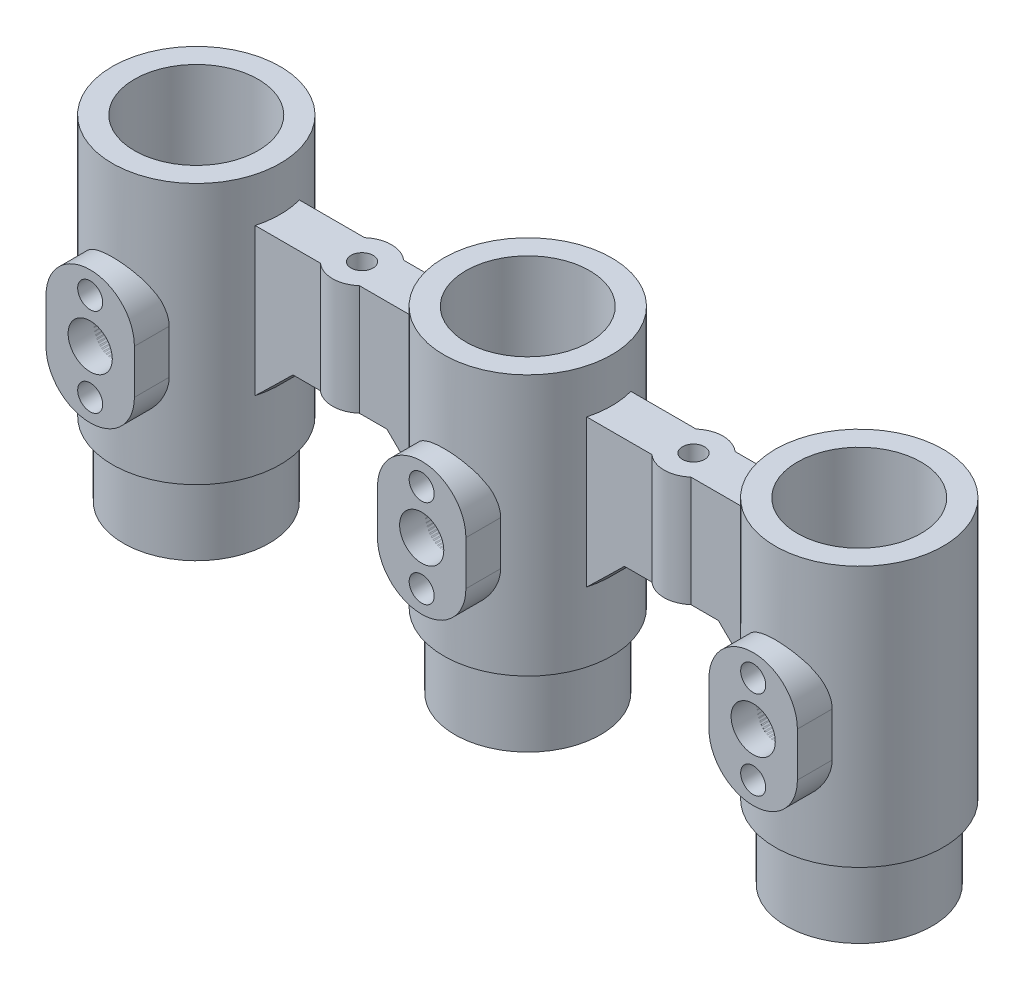
from build123d import *

# Parameters (mm, degrees)
SKETCH2_R           = 1.5
BOSS_EXTRUDE1_DEPTH = 15
SKETCH9_W           = 166.38618034
SKETCH9_H           = 90.507519626
CUT_EXTRUDE1_DEPTH  = 4
CHAMFER1_SIZE       = 5
SKETCH16_R          = 1.7
SKETCH16_R_2        = 3
BOSS_EXTRUDE9_DEPTH = 3
SKETCH16_8_R        = 1.7
SKETCH16_8_R_2      = 3
CUT_EXTRUDE7_DEPTH  = 10
LPATTERN11_COUNT    = 3
LPATTERN11_PITCH    = 45
LPATTERN11_2_COUNT  = 3
LPATTERN11_2_PITCH  = 45


with BuildPart() as part:
    # Sketch1 → Revolve2 (revolve)
    with BuildSketch(Plane.XY):
        Polygon((9.9, 14.584681722), (11.4, 14.584681722), (11.4, 54), (8.4, 54), (8.4, 4.584681722), (9.9, 4.584681722), align=None)
    revolve(axis=Axis((0, 51.150081367, 0), (0, -1, 0)))



with BuildPart() as body_2:
    # Sketch1<5> → Revolve3 (revolve)
    with BuildSketch(Plane.XY):
        Polygon((-35.1, 14.584681722), (-33.6, 14.584681722), (-33.6, 54), (-36.6, 54), (-36.6, 4.584681722), (-35.1, 4.584681722), align=None)
    revolve(axis=Axis((-45, 51.150081367, 0), (0, -1, 0)))


with BuildPart() as body_3:
    # Sketch1<6> → Revolve4 (revolve)
    with BuildSketch(Plane.XY):
        Polygon((56.4, 54), (53.4, 54), (53.4, 4.584681722), (54.9, 4.584681722), (54.9, 14.584681722), (56.4, 14.584681722), align=None)
    revolve(axis=Axis((45, 51.150081367, 0), (0, -1, 0)))


with BuildPart() as part_1:
    add(part.part)

    add(body_2.part)  # Boss-Extrude1 merges body 2

    add(body_3.part)  # Boss-Extrude1 merges body 3
    # Sketch2 → Boss-Extrude1 (add)
    # profile 1 of 2: a face of its own
    with BuildSketch(Plane(origin=(0, 44, 0), x_dir=(1, 0, 0), z_dir=(0, 1, 0))):
        with BuildLine():
            Line((10.998181668, 3), (10.998181668, -3))
            Line((10.998181668, -3), (19.854248689, -3))
            ThreePointArc((19.854248689, -3), (22.5, -4), (25.145751311, -3))
            Line((25.145751311, -3), (34.001818332, -3))
            Line((34.001818332, -3), (34.001818332, 3))
            Line((34.001818332, 3), (25.145751311, 3))
            ThreePointArc((25.145751311, 3), (22.5, 4), (19.854248689, 3))
            Line((19.854248689, 3), (10.998181668, 3))
        make_face()
        with Locations((22.5, 0)):
            Circle(SKETCH2_R, mode=Mode.SUBTRACT)
    # profile 2 of 2: a face of its own
    with BuildSketch(Plane(origin=(0, 44, 0), x_dir=(1, 0, 0), z_dir=(0, 1, 0))):
        with BuildLine():
            Line((-25.145751311, 3), (-34.001818332, 3))
            Line((-34.001818332, 3), (-34.001818332, -3))
            Line((-34.001818332, -3), (-25.145751311, -3))
            ThreePointArc((-25.145751311, -3), (-22.5, -4), (-19.854248689, -3))
            Line((-19.854248689, -3), (-10.998181668, -3))
            Line((-10.998181668, -3), (-10.998181668, 3))
            Line((-10.998181668, 3), (-19.854248689, 3))
            ThreePointArc((-19.854248689, 3), (-22.5, 4), (-25.145751311, 3))
        make_face()
        with Locations((-22.5, 0)):
            Circle(SKETCH2_R, mode=Mode.SUBTRACT)
    extrude(amount=-BOSS_EXTRUDE1_DEPTH)

    # Sketch9 → Cut-Extrude1 (cut)
    with BuildSketch(Plane(origin=(0, 54, 0), x_dir=(1, 0, 0), z_dir=(0, 1, 0))):
        with Locations((1.025387307, -1.43554223)):
            Rectangle(SKETCH9_W, SKETCH9_H)
    extrude(amount=-CUT_EXTRUDE1_DEPTH, mode=Mode.SUBTRACT)

    # Chamfer1
    chamfer1_edges = [part_1.edges().sort_by_distance(p)[0] for p in [
        (-11.4, 29, 0),
        (-33.70090112, 29, 1.513395022),
        (11.29909888, 29, 1.513395022),
        (33.6, 29, 0),
    ]]
    chamfer(chamfer1_edges, length=CHAMFER1_SIZE)

    # Sketch16<8> → Cut-Extrude7 (cut)
    with BuildSketch(Plane.XY.offset(11.4)):
        with Locations((45, 36)):
            Circle(SKETCH16_8_R)
        with Locations((45, 30)):
            Circle(SKETCH16_8_R_2)
        with Locations((45, 24)):
            Circle(SKETCH16_8_R)
    cut_extrude7 = extrude(amount=-CUT_EXTRUDE7_DEPTH, mode=Mode.SUBTRACT)

    # LPattern11 2: Cut-Extrude7 ×3
    with Locations(*[(-i * LPATTERN11_2_PITCH, 0, 0) for i in range(1, LPATTERN11_2_COUNT)]):
        add(cut_extrude7, mode=Mode.SUBTRACT)


with BuildPart() as body_2_2:
    # Sketch16 → Boss-Extrude9 (new, symmetric)
    with BuildSketch(Plane.XY.offset(11.4)):
        with BuildLine():
            ThreePointArc((51, 33), (45, 39), (39, 33))
            Line((39, 33), (39, 27))
            ThreePointArc((39, 27), (45, 21), (51, 27))
            Line((51, 27), (51, 33))
        make_face()
        with Locations((45, 36)):
            Circle(SKETCH16_R, mode=Mode.SUBTRACT)
        with Locations((45, 30)):
            Circle(SKETCH16_R_2, mode=Mode.SUBTRACT)
        with Locations((45, 24)):
            Circle(SKETCH16_R, mode=Mode.SUBTRACT)
    boss_extrude9 = extrude(amount=BOSS_EXTRUDE9_DEPTH, both=True)


with BuildPart() as lpattern11_1:
    # LPattern11: Boss-Extrude9 ×3
    with Locations(*[(-i * LPATTERN11_PITCH, 0, 0) for i in range(1, LPATTERN11_COUNT)]):
        add(boss_extrude9)


solid = Compound([part_1.part, body_2_2.part, lpattern11_1.part])
